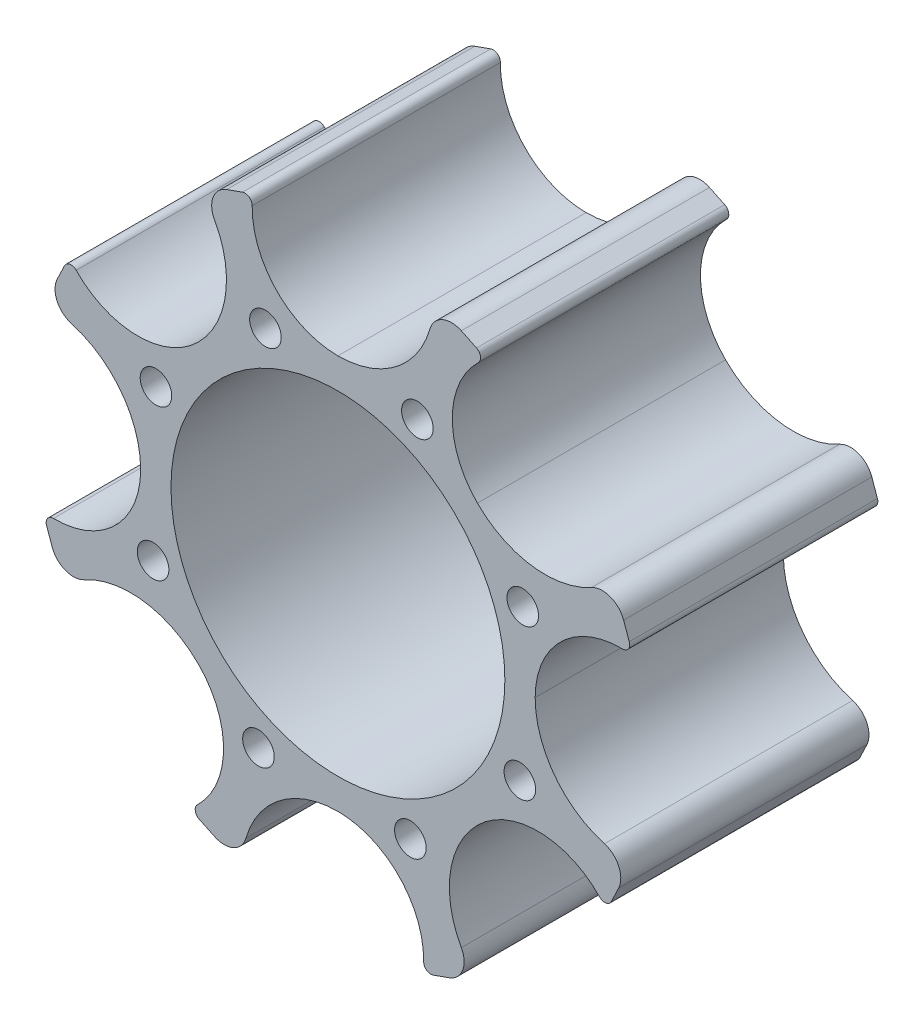
from build123d import *

# Parameters (mm, degrees)
EXTRUDE_1_DEPTH          = 27.5
SKETCH_2_R               = 18.5
CUT_EXTRUDE_1_DEPTH      = 54.353899797
SKETCH_3_R               = 1.75
CUT_EXTRUDE_2_DEPTH      = 54.353899797
CUT_EXTRUDE_3_DEPTH      = 5
PATTERN_CIRCULAR_1_COUNT = 8


with BuildPart() as part:
    # 草图1 → 凸台-拉伸1 (new body)
    with BuildSketch(Plane.XY):
        with BuildLine():
            Line((15.356969673, 30.298929166), (13.674015522, 31.101791788))
            ThreePointArc((13.674015522, 31.101791788), (11.571454033, 31.125101256), (10.194791162, 29.535727958))
            ThreePointArc((10.194791162, 29.535727958), (6.381394442, 23.991783581), (0, 21.857511157))
            ThreePointArc((0, 21.857511157), (-6.773355282, 24.696305694), (-9.498676044, 31.516109427))
            ThreePointArc((-9.498676044, 31.516109427), (-9.831389744, 32.178886119), (-10.565560882, 32.28359567))
            Line((-10.565560882, 32.28359567), (-12.323298779, 31.661276982))
            ThreePointArc((-12.323298779, 31.661276982), (-13.826516548, 30.191023779), (-13.676107562, 28.09371949))
            ThreePointArc((-13.676107562, 28.09371949), (-12.45242558, 21.477080146), (-15.455594359, 15.455594359))
            ThreePointArc((-15.455594359, 15.455594359), (-22.252410678, 12.673439775), (-29.001832935, 15.568676449))
            ThreePointArc((-29.001832935, 15.568676449), (-29.705750942, 15.802066229), (-30.298929166, 15.356969673))
            Line((-30.298929166, 15.356969673), (-31.101791788, 13.674015522))
            ThreePointArc((-31.101791788, 13.674015522), (-31.125101256, 11.571454033), (-29.535727958, 10.194791162))
            ThreePointArc((-29.535727958, 10.194791162), (-23.991783581, 6.381394442), (-21.857511157, 0))
            ThreePointArc((-21.857511157, 0), (-24.696305694, -6.773355282), (-31.516109427, -9.498676044))
            ThreePointArc((-31.516109427, -9.498676044), (-32.178886119, -9.831389744), (-32.28359567, -10.565560882))
            Line((-32.28359567, -10.565560882), (-31.661276982, -12.323298779))
            ThreePointArc((-31.661276982, -12.323298779), (-30.191023779, -13.826516548), (-28.09371949, -13.676107562))
            ThreePointArc((-28.09371949, -13.676107562), (-21.477080146, -12.45242558), (-15.455594359, -15.455594359))
            ThreePointArc((-15.455594359, -15.455594359), (-12.673439775, -22.252410678), (-15.568676449, -29.001832935))
            ThreePointArc((-15.568676449, -29.001832935), (-15.802066229, -29.705750942), (-15.356969673, -30.298929166))
            Line((-15.356969673, -30.298929166), (-13.674015522, -31.101791788))
            ThreePointArc((-13.674015522, -31.101791788), (-11.571454033, -31.125101256), (-10.194791162, -29.535727958))
            ThreePointArc((-10.194791162, -29.535727958), (-6.381394442, -23.991783581), (0, -21.857511157))
            ThreePointArc((0, -21.857511157), (6.773355282, -24.696305694), (9.498676044, -31.516109427))
            ThreePointArc((9.498676044, -31.516109427), (9.831389744, -32.178886119), (10.565560882, -32.28359567))
            Line((10.565560882, -32.28359567), (12.323298779, -31.661276982))
            ThreePointArc((12.323298779, -31.661276982), (13.826516548, -30.191023779), (13.676107562, -28.09371949))
            ThreePointArc((13.676107562, -28.09371949), (12.45242558, -21.477080146), (15.455594359, -15.455594359))
            ThreePointArc((15.455594359, -15.455594359), (22.252410678, -12.673439775), (29.001832935, -15.568676449))
            ThreePointArc((29.001832935, -15.568676449), (29.705750942, -15.802066229), (30.298929166, -15.356969673))
            Line((30.298929166, -15.356969673), (31.101791788, -13.674015522))
            ThreePointArc((31.101791788, -13.674015522), (31.125101256, -11.571454033), (29.535727958, -10.194791162))
            ThreePointArc((29.535727958, -10.194791162), (23.991783581, -6.381394442), (21.857511157, 0))
            ThreePointArc((21.857511157, 0), (24.696305694, 6.773355282), (31.516109427, 9.498676044))
            ThreePointArc((31.516109427, 9.498676044), (32.178886119, 9.831389744), (32.28359567, 10.565560882))
            Line((32.28359567, 10.565560882), (31.661276982, 12.323298779))
            ThreePointArc((31.661276982, 12.323298779), (30.191023779, 13.826516548), (28.09371949, 13.676107562))
            ThreePointArc((28.09371949, 13.676107562), (21.477080146, 12.45242558), (15.455594359, 15.455594359))
            ThreePointArc((15.455594359, 15.455594359), (12.673439775, 22.252410678), (15.568676449, 29.001832935))
            ThreePointArc((15.568676449, 29.001832935), (15.802066229, 29.705750942), (15.356969673, 30.298929166))
        make_face()
    extrude(amount=EXTRUDE_1_DEPTH)

    # 草图2 → 切除-拉伸1 (cut, through all)
    with BuildSketch(Plane(origin=(0, 0, 0), x_dir=(-1, 0, 0), z_dir=(0, 0, -1))):
        Circle(SKETCH_2_R)
    extrude(amount=-CUT_EXTRUDE_1_DEPTH, mode=Mode.SUBTRACT)

    # 草图3 → 切除-拉伸2 (cut, through all)
    with BuildSketch(Plane(origin=(0, 0, 0), x_dir=(-1, 0, 0), z_dir=(0, 0, -1))):
        with Locations((-8.804947053, 20.161173264)):
            Circle(SKETCH_3_R)
    cut_extrude_2 = extrude(amount=-CUT_EXTRUDE_2_DEPTH, mode=Mode.SUBTRACT)

    # 草图4 → 切除-拉伸3 (cut)
    with BuildSketch(Plane(origin=(0, 0, 0), x_dir=(-1, 0, 0), z_dir=(0, 0, -1))):
        Polygon((-10.098938684, 23.124097325), (-12.017910375, 20.52200567), (-10.723918744, 17.559081609), (-7.510955422, 17.198249203), (-5.591983731, 19.800340859), (-6.885975362, 22.76326492), align=None)
    cut_extrude_3 = extrude(amount=-CUT_EXTRUDE_3_DEPTH, mode=Mode.SUBTRACT)

    # 阵列(圆周)1: 切除-拉伸2, 切除-拉伸3 ×8 about axis
    pattern_circular_1_axis = Axis((0, 0, 27.5), (0, 0, -1))
    add([cut_extrude_2.rotate(pattern_circular_1_axis, i * 360 / PATTERN_CIRCULAR_1_COUNT) for i in range(1, PATTERN_CIRCULAR_1_COUNT)], mode=Mode.SUBTRACT)
    add([cut_extrude_3.rotate(pattern_circular_1_axis, i * 360 / PATTERN_CIRCULAR_1_COUNT) for i in range(1, PATTERN_CIRCULAR_1_COUNT)], mode=Mode.SUBTRACT)


solid = part.part
